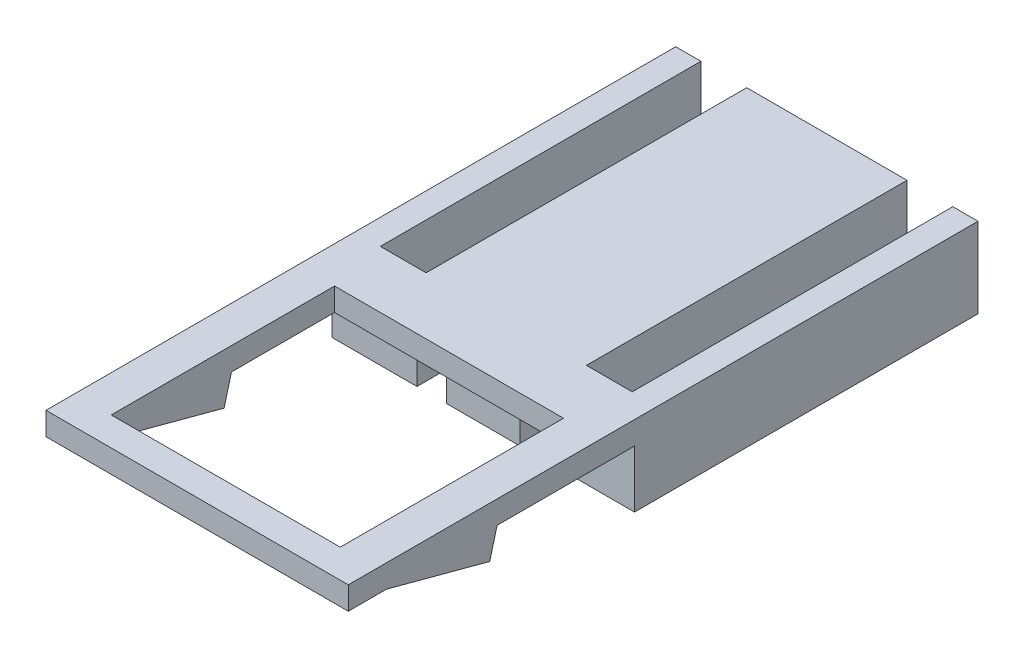
from build123d import *

# Parameters (mm, degrees)
SKETCH1_W           = 63.5
SKETCH1_H           = 35
BOSS_EXTRUDE1_DEPTH = 12
SKETCH3_W           = 26.4
SKETCH3_H           = 35
CUT_EXTRUDE2_DEPTH  = 5
SKETCH4_W           = 2.6
SKETCH4_H           = 35
CUT_EXTRUDE3_DEPTH  = 3.5
SKETCH5_W           = 18.55
SKETCH5_H           = 35
CUT_EXTRUDE4_DEPTH  = 49.755127935
SKETCH6_W           = 18.55
SKETCH6_H           = 35
CUT_EXTRUDE5_DEPTH  = 49.755127935
SKETCH7_W           = 4
SKETCH7_H           = 5
CUT_EXTRUDE6_DEPTH  = 40.284093473
SKETCH8_W           = 4
SKETCH8_H           = 5
CUT_EXTRUDE7_DEPTH  = 40.284093473
SKETCH12_W          = 26.4
SKETCH12_H          = 10
BOSS_EXTRUDE2_DEPTH = 27
SKETCH13_W          = 20
SKETCH13_H          = 19.5
CUT_EXTRUDE8_DEPTH  = 39.720020661
SKETCH14_W          = 27
SKETCH14_H          = 3
CUT_EXTRUDE9_DEPTH  = 47.335299718
SKETCH18_W          = 2.6
SKETCH18_H          = 3.5
CUT_EXTRUDE12_DEPTH = 40.284093473
SKETCH19_W          = 10
SKETCH19_H          = 5
CUT_EXTRUDE13_DEPTH = 46.452832695
SKETCH20_W          = 2.5
SKETCH20_H          = 5
CUT_EXTRUDE14_DEPTH = 46.452832695
CUT_EXTRUDE15_DEPTH = 46.452832695
SKETCH24_W          = 26.4
SKETCH24_H          = 2
CUT_EXTRUDE18_DEPTH = 5
SKETCH25_W          = 26.4
SKETCH25_H          = 7
CUT_EXTRUDE19_DEPTH = 39.05574858


with BuildPart() as part:
    # Sketch1 → Boss-Extrude1 (new body)
    with BuildSketch(Plane(origin=(0, 0, 0), x_dir=(1, 0, 0), z_dir=(0, 1, 0))):
        with Locations((0, 17.5)):
            Rectangle(SKETCH1_W, SKETCH1_H)
    extrude(amount=BOSS_EXTRUDE1_DEPTH)

    # Sketch3 → Cut-Extrude2 (cut)
    with BuildSketch(Plane.XZ):
        with Locations((0, -17.5)):
            Rectangle(SKETCH3_W, SKETCH3_H)
    extrude(amount=-CUT_EXTRUDE2_DEPTH, mode=Mode.SUBTRACT)

    # Sketch4 → Cut-Extrude3 (cut)
    with BuildSketch(Plane.XZ.offset(-5)):
        with Locations((-4.5, -17.5)):
            Rectangle(SKETCH4_W, SKETCH4_H)
        with Locations((4.5, -17.5)):
            Rectangle(SKETCH4_W, SKETCH4_H)
    extrude(amount=-CUT_EXTRUDE3_DEPTH, mode=Mode.SUBTRACT)

    # Sketch5 → Cut-Extrude4 (cut, through all)
    with BuildSketch(Plane.XZ):
        with Locations((-22.475, -17.5)):
            Rectangle(SKETCH5_W, SKETCH5_H)
    extrude(amount=-CUT_EXTRUDE4_DEPTH, mode=Mode.SUBTRACT)

    # Sketch6 → Cut-Extrude5 (cut, through all)
    with BuildSketch(Plane.XZ):
        with Locations((22.475, -17.5)):
            Rectangle(SKETCH6_W, SKETCH6_H)
    extrude(amount=-CUT_EXTRUDE5_DEPTH, mode=Mode.SUBTRACT)

    # Sketch7 → Cut-Extrude6 (cut, through all)
    with BuildSketch(Plane.XY):
        with Locations((-9, 9.5)):
            Rectangle(SKETCH7_W, SKETCH7_H)
    extrude(amount=-CUT_EXTRUDE6_DEPTH, mode=Mode.SUBTRACT)

    # Sketch8 → Cut-Extrude7 (cut, through all)
    with BuildSketch(Plane.XY):
        with Locations((9, 9.5)):
            Rectangle(SKETCH8_W, SKETCH8_H)
    extrude(amount=-CUT_EXTRUDE7_DEPTH, mode=Mode.SUBTRACT)

    # Sketch12 → Boss-Extrude2 (add)
    with BuildSketch(Plane.XY):
        with Locations((0, 10)):
            Rectangle(SKETCH12_W, SKETCH12_H)
    extrude(amount=BOSS_EXTRUDE2_DEPTH)

    # Sketch13 → Cut-Extrude8 (cut, through all)
    with BuildSketch(Plane(origin=(0, 15, 0), x_dir=(1, 0, 0), z_dir=(0, 1, 0))):
        with Locations((0, -14.75)):
            Rectangle(SKETCH13_W, SKETCH13_H)
    extrude(amount=-CUT_EXTRUDE8_DEPTH, mode=Mode.SUBTRACT)

    # Sketch14 → Cut-Extrude9 (cut, through all)
    with BuildSketch(Plane.ZY.offset(13.2)):
        with Locations((13.5, 13.5)):
            Rectangle(SKETCH14_W, SKETCH14_H)
    extrude(amount=-CUT_EXTRUDE9_DEPTH, mode=Mode.SUBTRACT)

    # Sketch18 → Cut-Extrude12 (cut, through all)
    with BuildSketch(Plane(origin=(0, 0, 0), x_dir=(-1, 0, 0), z_dir=(0, 0, -1))):
        with Locations((4.5, 6.75)):
            Rectangle(SKETCH18_W, SKETCH18_H)
        with Locations((-4.5, 6.75)):
            Rectangle(SKETCH18_W, SKETCH18_H)
    extrude(amount=-CUT_EXTRUDE12_DEPTH, mode=Mode.SUBTRACT)

    # Sketch19 → Cut-Extrude13 (cut, through all)
    with BuildSketch(Plane.ZY.offset(13.2)):
        with Locations((9, 7.5)):
            Rectangle(SKETCH19_W, SKETCH19_H)
    extrude(amount=-CUT_EXTRUDE13_DEPTH, mode=Mode.SUBTRACT)

    # Sketch20 → Cut-Extrude14 (cut, through all)
    with BuildSketch(Plane.ZY.offset(13.2)):
        with Locations((25.75, 7.5)):
            Rectangle(SKETCH20_W, SKETCH20_H)
    extrude(amount=-CUT_EXTRUDE14_DEPTH, mode=Mode.SUBTRACT)

    # Sketch21 → Cut-Extrude15 (cut, through all)
    with BuildSketch(Plane.ZY.offset(13.2)):
        Polygon((14, 10), (14.647047613, 7.585185434), (23.6593, 10), (24.5, 10), (24.5, 5), (14, 5), align=None)
    extrude(amount=-CUT_EXTRUDE15_DEPTH, mode=Mode.SUBTRACT)

    # Sketch24 → Cut-Extrude18 (cut)
    with BuildSketch(Plane.XZ.offset(-5)):
        with Locations((0, 3)):
            Rectangle(SKETCH24_W, SKETCH24_H)
    extrude(amount=-CUT_EXTRUDE18_DEPTH, mode=Mode.SUBTRACT)

    # Sketch25 → Cut-Extrude19 (cut, through all)
    with BuildSketch(Plane(origin=(0, 12, 0), x_dir=(1, 0, 0), z_dir=(0, 1, 0))):
        with Locations((0, 31.5)):
            Rectangle(SKETCH25_W, SKETCH25_H)
    extrude(amount=-CUT_EXTRUDE19_DEPTH, mode=Mode.SUBTRACT)


solid = part.part
